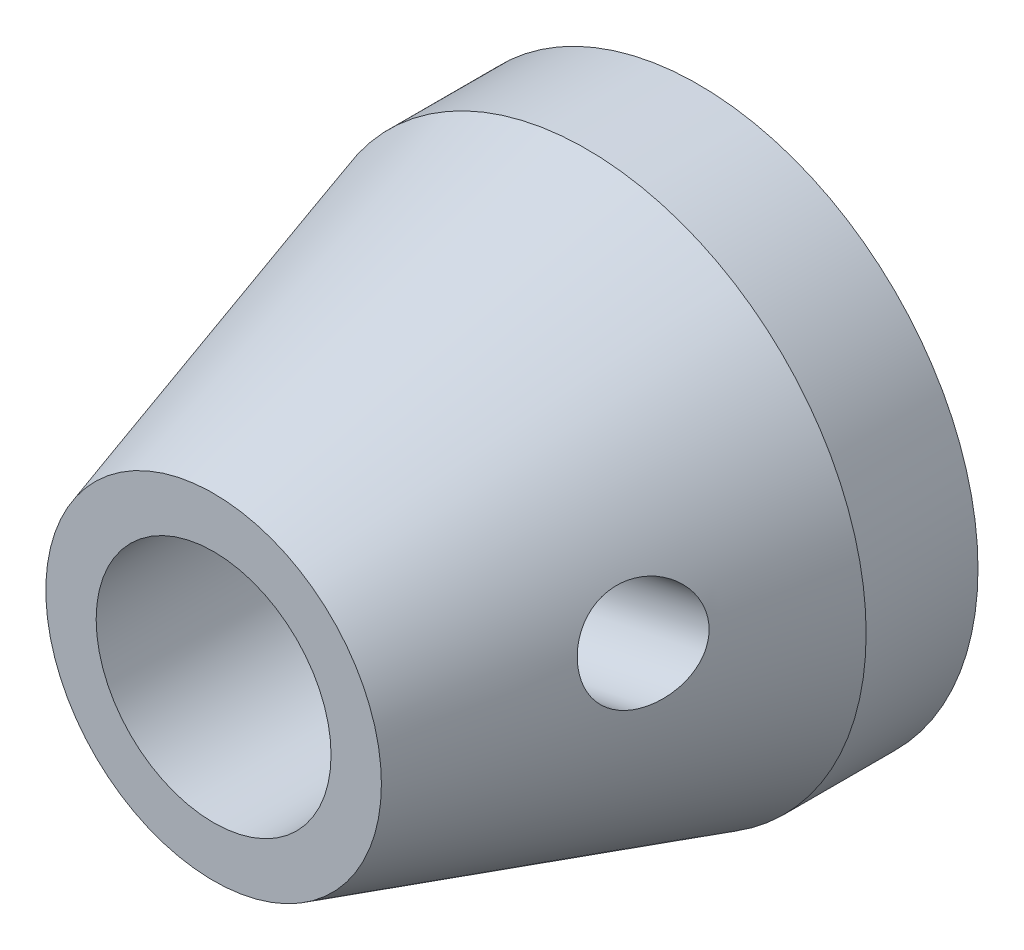
from build123d import *

# Parameters (mm, degrees)
SKETCH_6_R               = 7.5
EXTRUDE_1_DEPTH          = 3
SKETCH_7_R               = 4.5
SKETCH_7_R_2             = 3.15
EXTRUDE_2_DEPTH          = 10
SKETCH_9_R               = 1.65
CUT_EXTRUDE_1_DEPTH      = 3
CHAMFER_1_SIZE           = 3
CHAMFER_1_SIZE_2         = 10
CUT_EXTRUDE_2_DEPTH      = 37.903513147
CUT_EXTRUDE_2_DEPTH_BACK = 37.903513147
SKETCH_10_R              = 1.35


with BuildPart() as part:
    # 草图6 → 凸台-拉伸1 (new body)
    with BuildSketch(Plane.XY):
        with Locations((18.143108258, 29.936835998)):
            Circle(SKETCH_6_R)
    extrude(amount=EXTRUDE_1_DEPTH)

    # 草图7 → 凸台-拉伸2 (add)
    with BuildSketch(Plane.XY.offset(3)):
        with Locations((18.143108258, 29.936835998)):
            Circle(SKETCH_7_R)
        with Locations((18.143108258, 29.936835998)):
            Circle(SKETCH_7_R_2, mode=Mode.SUBTRACT)
    extrude(amount=EXTRUDE_2_DEPTH)

    # 草图9 → 切除-拉伸1 (cut)
    with BuildSketch(Plane.XY.offset(3)):
        with Locations((18.143108258, 29.936835998)):
            Circle(SKETCH_9_R)
    extrude(amount=-CUT_EXTRUDE_1_DEPTH, mode=Mode.SUBTRACT)

    # 倒角1
    # the kernel refuses this chamfer: 10, 3 mm, written as the material it adds along each edge
    with BuildSketch(Plane(origin=(18.143108258, 29.936835998, 3), x_dir=(1, 0, 0), z_dir=(0, -1, 0))) as chamfer_1_piece_1_section:
        Polygon((4.5 + CHAMFER_1_SIZE, 0), (4.5, CHAMFER_1_SIZE_2), (4.5, 0), align=None)
    chamfer_1_piece_1 = revolve(axis=Axis((18.143108258, 29.936835998, 3), (0, 0, 1)), mode=Mode.PRIVATE)
    chamfer_1_piece_1 = chamfer_1_piece_1 & Plane(origin=(18.143108258, 29.936835998, 7.975650117), x_dir=(1, 0, 0), z_dir=(0, 0, -1)) * Cylinder(7.5, 40, mode=Mode.PRIVATE)
    chamfer_1_piece_1 = split(chamfer_1_piece_1, bisect_by=Plane(origin=(12.224274533, 29.936835998, 13), z_dir=(0, 0, -1)), keep=Keep.TOP, mode=Mode.PRIVATE)
    add(chamfer_1_piece_1)

    # 草图10 → 切除-拉伸2 (cut, two sides: drawn at the far end of the back side and taken through both)
    with BuildSketch(Plane(origin=(18.921476442, 3.905687751, 0), x_dir=(0, 0, 1), z_dir=(-0.9793537694565077, -0.20215388754938593, 0)).offset(-CUT_EXTRUDE_2_DEPTH_BACK)):
        with Locations(Location((7.5, 25.651053313, 0), (0, 0, 270))):
            Circle(SKETCH_10_R)
    extrude(amount=CUT_EXTRUDE_2_DEPTH + CUT_EXTRUDE_2_DEPTH_BACK, mode=Mode.SUBTRACT)


solid = part.part
